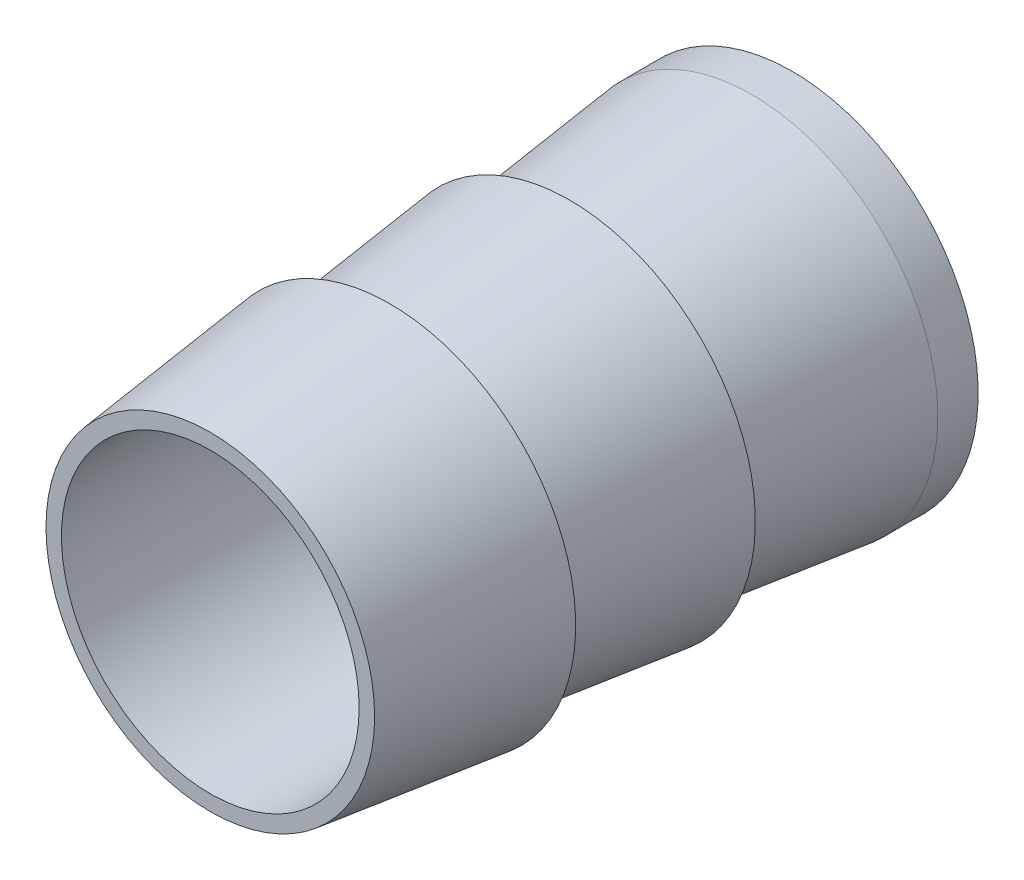
from build123d import *

# Parameters (mm, degrees)
SKETCH3_R          = 3.81
CUT_EXTRUDE1_DEPTH = 17.345953521


with BuildPart() as part:
    # Sketch2 → Barbfitting(Mcmaster) (revolve)
    with BuildSketch(Plane(origin=(0, 0, 0), x_dir=(0, 0, -1), z_dir=(1, 0, 0))):
        Polygon((8.7391875, 0), (-6.154683186, 0), (-6.154683186, 4.205934994), (-6.005566814, 4.223690006), (-1.554901936, 4.753622494), (-1.554901936, 4.205934994), (-1.405785564, 4.223690006), (3.044879314, 4.753622494), (3.044879314, 4.205934994), (3.193995686, 4.223690006), (7.707996691, 4.76116381), (8.7391875, 4.7625), align=None)
    revolve(axis=Axis((0, 0, -8.7391875), (0, 0, 1)))

    # Sketch3 → Cut-Extrude1 (cut, through all)
    with BuildSketch(Plane.XY.offset(6.154683186)):
        Circle(SKETCH3_R)
    extrude(amount=-CUT_EXTRUDE1_DEPTH, mode=Mode.SUBTRACT)


solid = part.part
